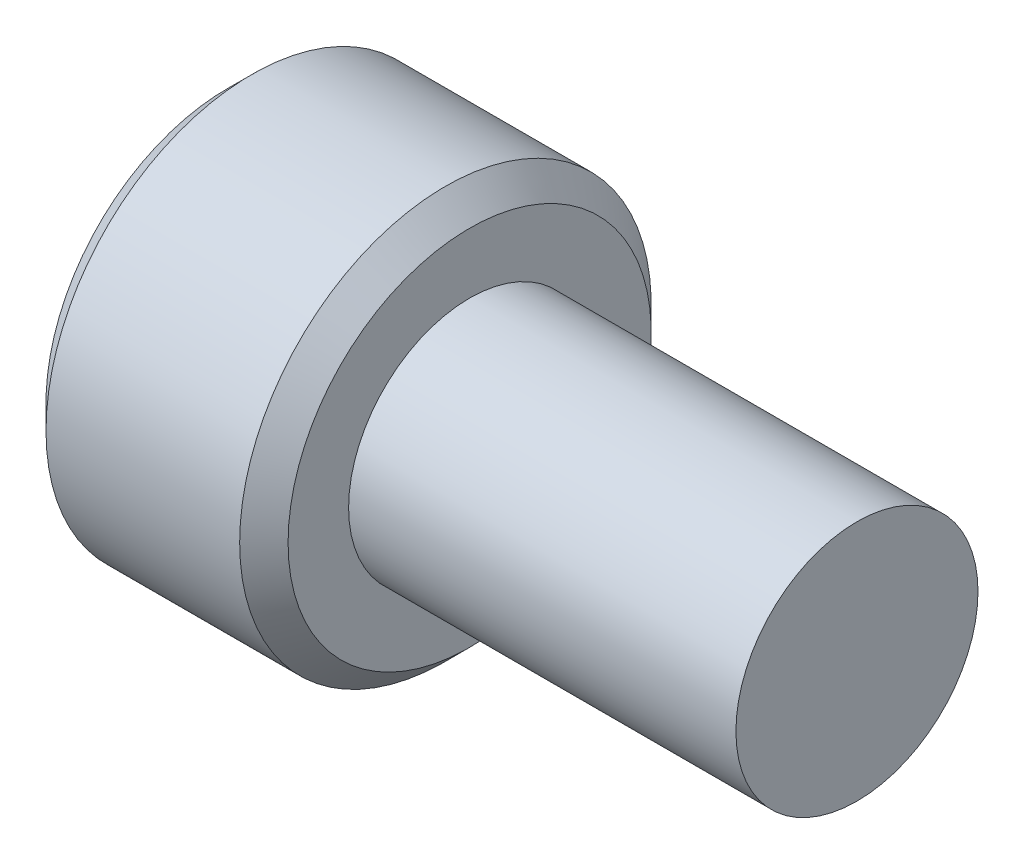
from build123d import *

# Parameters (mm, degrees)
CUT_EXTRUDE1_DEPTH = 2
CHAMFER1_SIZE      = 0.5


with BuildPart() as part:
    # Sketch1 → Revolve1 (revolve)
    with BuildSketch(Plane.XY):
        Polygon((0, 2.5), (8, 2.5), (8, 0), (-5, 0), (-5, 4.25), (0, 4.25), align=None)
    revolve(axis=Axis((-5.65, 0, 0), (1, 0, 0)))

    # Sketch2 → Cut-Revolve1 (revolve, cut)
    with BuildSketch(Plane.XY):
        Polygon((-1.798278762, 0), (-3, 2), (-5, 2), (-5, 0), align=None)
    revolve(axis=Axis((-5.65, 0, 0), (1, 0, 0)), mode=Mode.SUBTRACT)

    # Sketch3 → Cut-Extrude1 (cut)
    with BuildSketch(Plane.ZY.offset(5)):
        Polygon((2, 1.154700538), (0, 2.309401077), (-2, 1.154700538), (-2, -1.154700538), (0, -2.309401077), (2, -1.154700538), align=None)
    extrude(amount=-CUT_EXTRUDE1_DEPTH, mode=Mode.SUBTRACT)

    # Chamfer1
    chamfer1_edges = [part.edges().sort_by_distance(p)[0] for p in [
        (0, -4.25, 0),
        (-5, -4.25, 0),
    ]]
    chamfer(chamfer1_edges, length=CHAMFER1_SIZE)


solid = part.part
